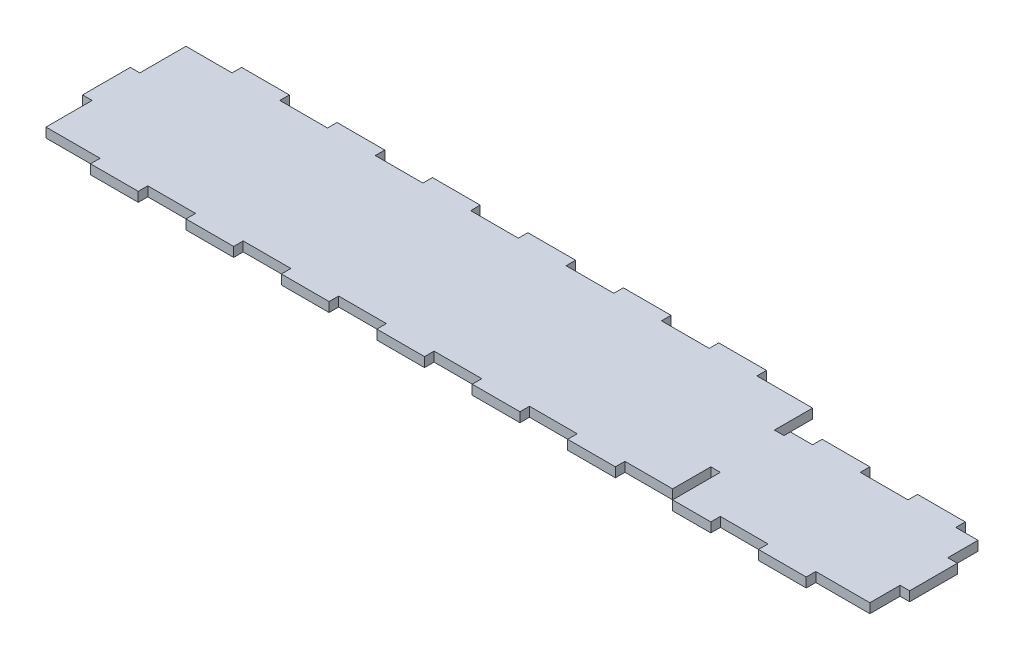
from build123d import *

# Parameters (mm, degrees)
SALIENTE_EXTRUIR1_DEPTH = 3


with BuildPart() as part:
    # Croquis1 → Saliente-Extruir1 (new body)
    with BuildSketch(Plane(origin=(0, 0, 0), x_dir=(1, 0, 0), z_dir=(0, 1, 0))):
        Polygon((32.5, 50), (17.5, 50), (17.5, 47), (3, 47), (3, 32.5), (0, 32.5), (0, 25), (0, 17.5), (3, 17.5), (3, 3), (20, 3), (20, 0), (35, 0), (35, 3), (50, 3), (50, 0), (65, 0), (65, 3), (80, 3), (80, 0), (95, 0), (95, 3), (110, 3), (110, 0), (125, 0), (125, 3), (140, 3), (140, 0), (155, 0), (155, 3), (170, 3), (170, 0), (185, 0), (185, 3), (197, 3), (200, 3), (200, 15), (203, 15), (203, 0), (215, 0), (215, 3), (230, 3), (230, 0), (245, 0), (245, 3), (262, 3), (262, 12.5), (265, 12.5), (265, 20), (265, 27.5), (262, 27.5), (262, 37), (255, 37), (255, 40), (240, 40), (240, 37), (225, 37), (225, 40), (210, 40), (210, 37), (203, 37), (203, 35), (200, 35), (200, 37), (200, 47), (197, 47), (182.5, 47), (182.5, 50), (167.5, 50), (167.5, 47), (152.5, 47), (152.5, 50), (137.5, 50), (137.5, 47), (122.5, 47), (122.5, 50), (107.5, 50), (107.5, 47), (92.5, 47), (92.5, 50), (77.5, 50), (77.5, 47), (62.5, 47), (62.5, 50), (47.5, 50), (47.5, 47), (32.5, 47), align=None)
    extrude(amount=SALIENTE_EXTRUIR1_DEPTH)


solid = part.part
